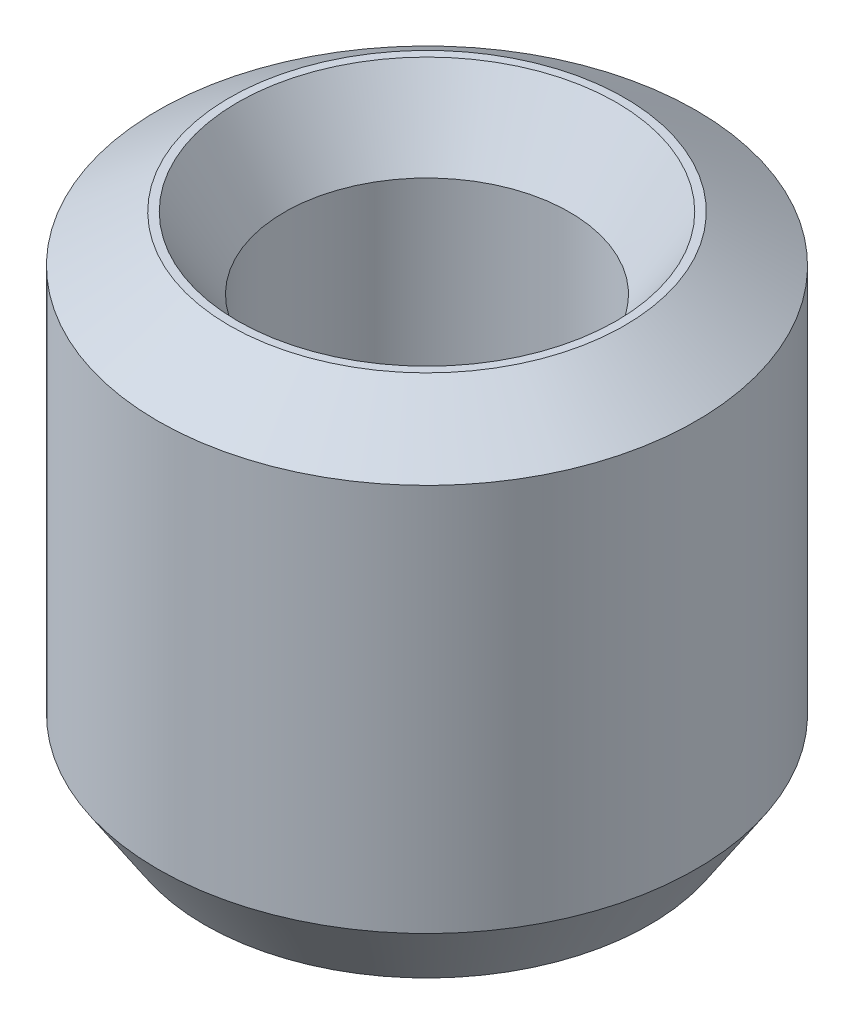
from build123d import *
from OCP.BRepFilletAPI import BRepFilletAPI_MakeChamfer

# Parameters (mm, degrees)
SKETCH1_R           = 20
BOSS_EXTRUDE1_DEPTH = 37.641972747
SKETCH2_R           = 10.591831883
CUT_EXTRUDE1_DEPTH  = 48.084159887
CHAMFER1_SIZE       = 3.478767998
CHAMFER1_SIZE2      = 5.322784165


with BuildPart() as part:
    # Sketch1 → Boss-Extrude1 (new body)
    with BuildSketch(Plane(origin=(0, 0, 0), x_dir=(1, 0, 0), z_dir=(0, 1, 0))):
        Circle(SKETCH1_R)
    extrude(amount=BOSS_EXTRUDE1_DEPTH)

    # Sketch2 → Cut-Extrude1 (cut, through all)
    with BuildSketch(Plane(origin=(0, 0, 0), x_dir=(1, 0, 0), z_dir=(0, 1, 0))):
        Circle(SKETCH2_R)
    extrude(amount=CUT_EXTRUDE1_DEPTH, mode=Mode.SUBTRACT)

    # Chamfer1: one chamfer whose edges measure the first distance from different faces: ONE call of the kernel's chamfer builder (chamfer() names one face for all edges)
    chamfer1_edges_1 = [part.edges().sort_by_distance(p)[0] for p in [
        (-10.591831883, 37.641972747, 0),
    ]]
    chamfer1_side_1 = [part.faces().sort_by_distance(p)[0] for p in [
        (-19.434314575, 37.641972747, 0),
    ]]
    chamfer1_edges_2 = [part.edges().sort_by_distance(p)[0] for p in [
        (-10.591831883, 0, 0),
    ]]
    chamfer1_side_2 = [part.faces().sort_by_distance(p)[0] for p in [
        (-10.591831883, 18.820986373, 0),
    ]]
    chamfer1_edges_3 = [part.edges().sort_by_distance(p)[0] for p in [
        (-20, 0, 0),
    ]]
    chamfer1_side_3 = [part.faces().sort_by_distance(p)[0] for p in [
        (-19.434314575, 0, 0),
    ]]
    chamfer1_edges_4 = [part.edges().sort_by_distance(p)[0] for p in [
        (-20, 37.641972747, 0),
    ]]
    chamfer1_side_4 = [part.faces().sort_by_distance(p)[0] for p in [
        (-20, 18.820986373, 0),
    ]]
    chamfer1 = BRepFilletAPI_MakeChamfer(part.part.solid().wrapped)
    for e in chamfer1_edges_1:
        chamfer1.Add(CHAMFER1_SIZE, CHAMFER1_SIZE2, e.wrapped, chamfer1_side_1[0].wrapped)  # the first distance lies on this face
    for e in chamfer1_edges_2:
        chamfer1.Add(CHAMFER1_SIZE, CHAMFER1_SIZE2, e.wrapped, chamfer1_side_2[0].wrapped)  # the first distance lies on this face
    for e in chamfer1_edges_3:
        chamfer1.Add(CHAMFER1_SIZE, CHAMFER1_SIZE2, e.wrapped, chamfer1_side_3[0].wrapped)  # the first distance lies on this face
    for e in chamfer1_edges_4:
        chamfer1.Add(CHAMFER1_SIZE, CHAMFER1_SIZE2, e.wrapped, chamfer1_side_4[0].wrapped)  # the first distance lies on this face
    add(Compound.cast(chamfer1.Shape()), mode=Mode.REPLACE)


solid = part.part
